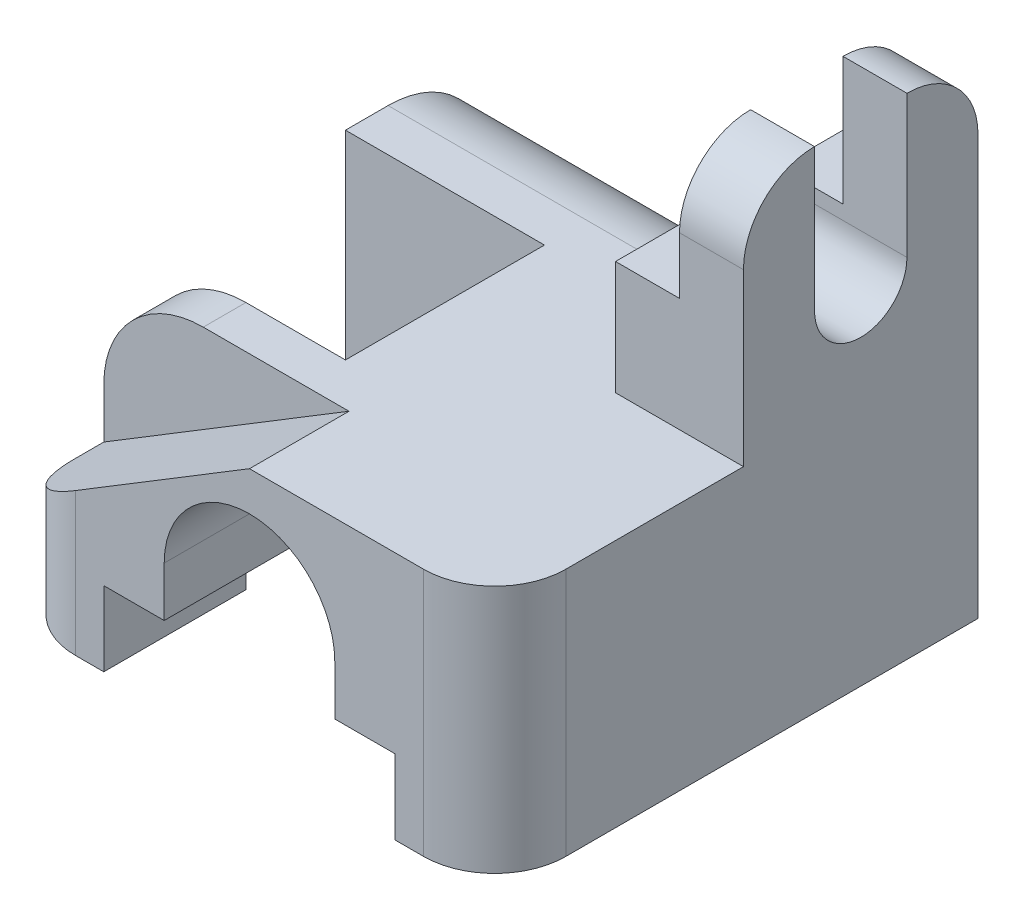
from build123d import *

# Parameters (mm, degrees)
SKETCH1_W           = 69
SKETCH1_H           = 35
BOSS_EXTRUDE1_DEPTH = 68
CUT_EXTRUDE1_DEPTH  = 79.233624485
FILLET1_R           = 10
CUT_EXTRUDE2_DEPTH  = 14
CUT_EXTRUDE3_DEPTH  = 14
SKETCH6_W           = 18
SKETCH6_H           = 16
BOSS_EXTRUDE2_DEPTH = 33
CUT_EXTRUDE4_DEPTH  = 28
FILLET3_R           = 14
BOSS_EXTRUDE3_DEPTH = 9
FILLET4_R           = 14


with BuildPart() as part:
    # Sketch1 → Boss-Extrude1 (new body)
    with BuildSketch(Plane.XY):
        Rectangle(SKETCH1_W, SKETCH1_H)
    extrude(amount=-BOSS_EXTRUDE1_DEPTH)

    # Sketch2 → Cut-Extrude1 (cut, through all)
    with BuildSketch(Plane.XY):
        with BuildLine():
            Line((-20.5, -17.5), (-20.5, -7))
            Line((-20.5, -7), (-12, -7))
            Line((-12, -7), (-12, 0))
            ThreePointArc((-12, 0), (0, 12), (12, 0))
            Line((12, 0), (12, -7))
            Line((12, -7), (20.5, -7))
            Line((20.5, -7), (20.5, -17.5))
            Line((20.5, -17.5), (-20.5, -17.5))
        make_face()
    extrude(amount=-CUT_EXTRUDE1_DEPTH, mode=Mode.SUBTRACT)

    # Fillet1
    fillet1_edges = [part.edges().sort_by_distance(p)[0] for p in [
        (34.5, 0, 0),
        (-34.5, 0, 0),
    ]]
    fillet(fillet1_edges, radius=FILLET1_R)

    # Sketch4 → Cut-Extrude2 (cut)
    with BuildSketch(Plane.XY):
        Polygon((0, 17.5), (-34.5, -3.5), (-34.5, 17.5), align=None)
    extrude(amount=-CUT_EXTRUDE2_DEPTH, mode=Mode.SUBTRACT)

    # Sketch5 → Cut-Extrude3 (cut, symmetric)
    with BuildSketch(Plane.XY.offset(-34)):
        with BuildLine():
            Line((-34.5, -17.5), (-20.5, -17.5))
            Line((-20.5, -17.5), (-20.5, -10.5))
            Line((-20.5, -10.5), (-11.239870411, -10.5))
            Line((-11.239870411, -10.5), (-11.239870411, 0))
            ThreePointArc((-11.239870411, 0), (-10, 5.760129589), (-6.5, 10.5))
            Line((-6.5, 10.5), (-6.5, 17.5))
            Line((-6.5, 17.5), (-34.5, 17.5))
            Line((-34.5, 17.5), (-34.5, -17.5))
        make_face()
    extrude(amount=CUT_EXTRUDE3_DEPTH, both=True, mode=Mode.SUBTRACT)

    # Sketch6 → Boss-Extrude2 (add)
    with BuildSketch(Plane.XY.offset(-35)):
        with Locations((25.5, 25.5)):
            Rectangle(SKETCH6_W, SKETCH6_H)
    extrude(amount=-BOSS_EXTRUDE2_DEPTH)

    # Sketch7 → Cut-Extrude4 (cut)
    with BuildSketch(Plane.ZY.offset(-16.5)):
        with BuildLine():
            Line((-58, 33.5), (-58, 31.5))
            ThreePointArc((-58, 31.5), (-51.5, 25), (-45, 31.5))
            Line((-45, 31.5), (-45, 33.5))
            Line((-45, 33.5), (-58, 33.5))
        make_face()
    extrude(amount=-CUT_EXTRUDE4_DEPTH, mode=Mode.SUBTRACT)

    # Fillet3
    # the kernel refuses this fillet: 14 mm, written as the material it takes off along each edge
    with BuildSketch(Plane(origin=(-69.5, 17.5, -68), x_dir=(0, -1, 0), z_dir=(1, 0, 0))) as fillet3_piece_1:
        with BuildLine():
            CenterArc((FILLET3_R, -FILLET3_R), FILLET3_R, 90, 90)
            Line((0, -FILLET3_R), (0, 0))
            Line((0, 0), (FILLET3_R, 0))
        make_face()
    extrude(amount=86, mode=Mode.SUBTRACT)

    # Sketch9 → Boss-Extrude3 (add)
    with BuildSketch(Plane(origin=(34.5, 0, 0), x_dir=(0, 0, -1), z_dir=(1, 0, 0))):
        with BuildLine():
            Line((58, 33.5), (58, 51.5))
            ThreePointArc((58, 51.5), (65.071067812, 48.571067812), (68, 41.5))
            Line((68, 41.5), (68, 33.5))
            Line((68, 33.5), (58, 33.5))
        make_face()
        with BuildLine():
            Line((45, 33.5), (45, 51.5))
            ThreePointArc((45, 51.5), (37.928932188, 48.571067812), (35, 41.5))
            Line((35, 41.5), (35, 33.5))
            Line((35, 33.5), (45, 33.5))
        make_face()
    extrude(amount=-BOSS_EXTRUDE3_DEPTH)

    # Fillet4
    fillet4_edges = [part.edges().sort_by_distance(p)[0] for p in [
        (-34.5, 17.5, -17),
    ]]
    fillet(fillet4_edges, radius=FILLET4_R)


solid = part.part
